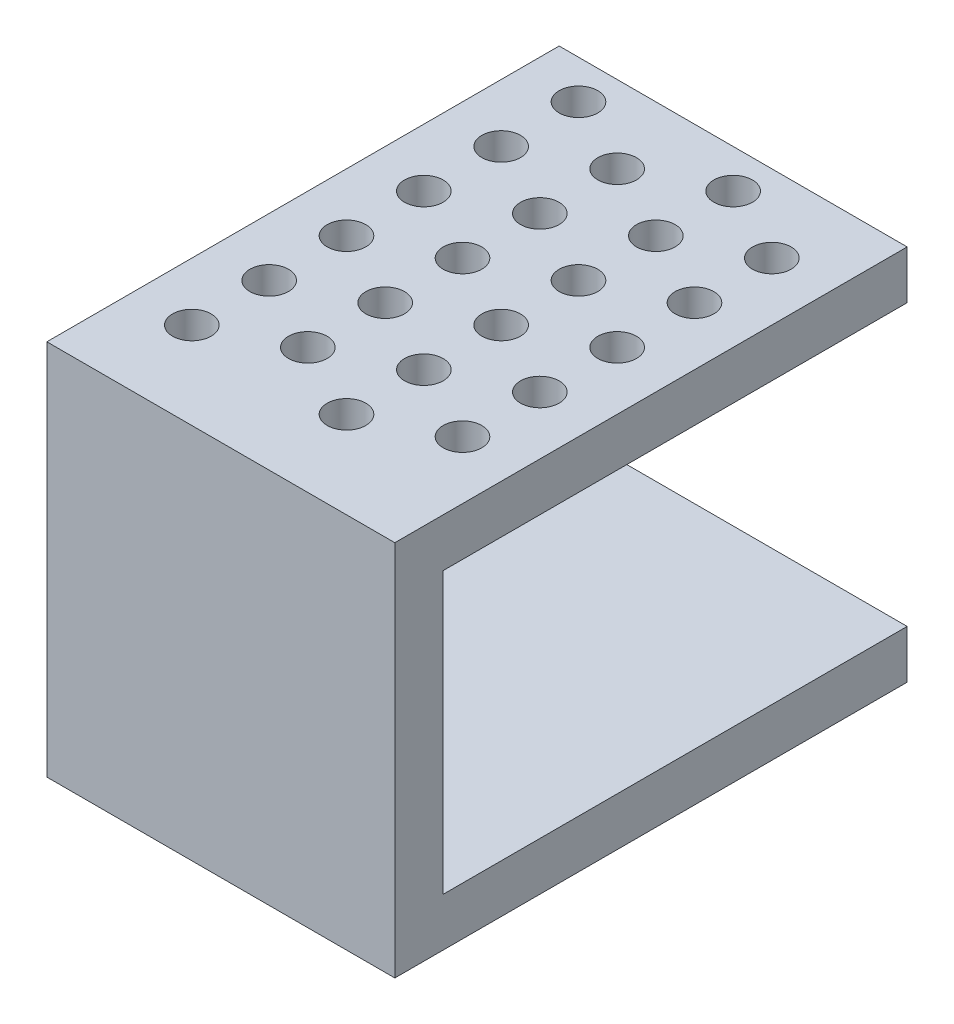
from build123d import *

# Parameters (mm, degrees)
SKETCH2_W           = 18
SKETCH2_H           = 24
SKETCH2_R           = 1
BOSS_EXTRUDE2_DEPTH = 2.5
SKETCH3_W           = 18
SKETCH3_H           = 2.5
BOSS_EXTRUDE3_DEPTH = 2.5
SKETCH4_W           = 18
SKETCH4_H           = 2.5
BOSS_EXTRUDE4_DEPTH = 17
SKETCH5_W           = 18
SKETCH5_H           = 2.5
BOSS_EXTRUDE5_DEPTH = 24


with BuildPart() as part:
    # Sketch2 → Boss-Extrude2 (new body)
    with BuildSketch(Plane(origin=(0, 0, 0), x_dir=(1, 0, 0), z_dir=(0, 1, 0))):
        with Locations((-11, 4)):
            Rectangle(SKETCH2_W, SKETCH2_H)
        with Locations((-17, -6)):
            Circle(SKETCH2_R, mode=Mode.SUBTRACT)
        with Locations((-17, -2)):
            Circle(SKETCH2_R, mode=Mode.SUBTRACT)
        with Locations((-17, 2)):
            Circle(SKETCH2_R, mode=Mode.SUBTRACT)
        with Locations((-17, 6)):
            Circle(SKETCH2_R, mode=Mode.SUBTRACT)
        with Locations((-17, 10)):
            Circle(SKETCH2_R, mode=Mode.SUBTRACT)
        with Locations((-17, 14)):
            Circle(SKETCH2_R, mode=Mode.SUBTRACT)
        with Locations((-13, -4)):
            Circle(SKETCH2_R, mode=Mode.SUBTRACT)
        with Locations((-13, 0)):
            Circle(SKETCH2_R, mode=Mode.SUBTRACT)
        with Locations((-13, 4)):
            Circle(SKETCH2_R, mode=Mode.SUBTRACT)
        with Locations((-13, 8)):
            Circle(SKETCH2_R, mode=Mode.SUBTRACT)
        with Locations((-13, 12)):
            Circle(SKETCH2_R, mode=Mode.SUBTRACT)
        with Locations((-9, -6)):
            Circle(SKETCH2_R, mode=Mode.SUBTRACT)
        with Locations((-9, -2)):
            Circle(SKETCH2_R, mode=Mode.SUBTRACT)
        with Locations((-9, 2)):
            Circle(SKETCH2_R, mode=Mode.SUBTRACT)
        with Locations((-9, 6)):
            Circle(SKETCH2_R, mode=Mode.SUBTRACT)
        with Locations((-9, 10)):
            Circle(SKETCH2_R, mode=Mode.SUBTRACT)
        with Locations((-9, 14)):
            Circle(SKETCH2_R, mode=Mode.SUBTRACT)
        with Locations((-5, -4)):
            Circle(SKETCH2_R, mode=Mode.SUBTRACT)
        with Locations((-5, 0)):
            Circle(SKETCH2_R, mode=Mode.SUBTRACT)
        with Locations((-5, 4)):
            Circle(SKETCH2_R, mode=Mode.SUBTRACT)
        with Locations((-5, 8)):
            Circle(SKETCH2_R, mode=Mode.SUBTRACT)
        with Locations((-5, 12)):
            Circle(SKETCH2_R, mode=Mode.SUBTRACT)
    extrude(amount=BOSS_EXTRUDE2_DEPTH)

    # Sketch3 → Boss-Extrude3 (add)
    with BuildSketch(Plane.XY.offset(8)):
        with Locations((-11, 1.25)):
            Rectangle(SKETCH3_W, SKETCH3_H)
    extrude(amount=BOSS_EXTRUDE3_DEPTH)

    # Sketch4 → Boss-Extrude4 (add)
    with BuildSketch(Plane(origin=(0, 0, 0), x_dir=(-1, 0, 0), z_dir=(0, -1, 0))):
        with Locations((11, -9.25)):
            Rectangle(SKETCH4_W, SKETCH4_H)
    extrude(amount=BOSS_EXTRUDE4_DEPTH)

    # Sketch5 → Boss-Extrude5 (add)
    with BuildSketch(Plane(origin=(0, 0, 8), x_dir=(-1, 0, 0), z_dir=(0, 0, -1))):
        with Locations((11, -15.75)):
            Rectangle(SKETCH5_W, SKETCH5_H)
    extrude(amount=BOSS_EXTRUDE5_DEPTH)


solid = part.part
